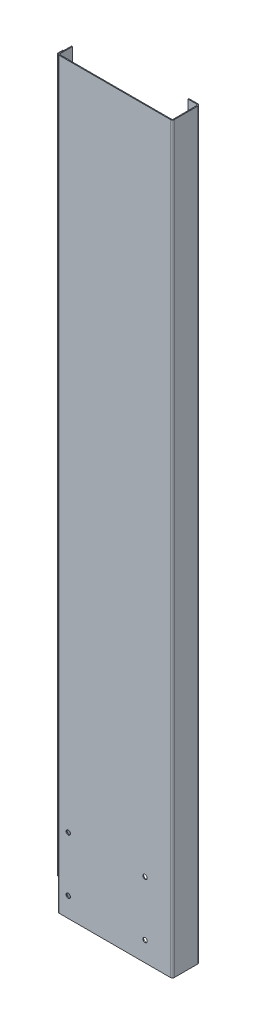
from build123d import *

# Parameters (mm, degrees)
SKETCH_15_W                      = 105
SKETCH_15_H                      = 678
SM_BASE_FLANGE_1_DEPTH           = 0.8
SM_EDGE_FLANGE_1_STRIP_W         = 5.2
SM_EDGE_FLANGE_1_STRIP_H         = 0.8
SM_EDGE_FLANGE_1_STRIP_CUT_DEPTH = 678
SM_EDGE_FLANGE_1_DEPTH           = 678
SM_EDGE_FLANGE_2_STRIP_W         = 5.2
SM_EDGE_FLANGE_2_STRIP_H         = 0.8
SM_EDGE_FLANGE_2_STRIP_CUT_DEPTH = 678
SM_EDGE_FLANGE_2_DEPTH           = 678
SM_EDGE_FLANGE_3_STRIP_W         = 5.2
SM_EDGE_FLANGE_3_STRIP_H         = 0.8
SM_EDGE_FLANGE_3_STRIP_CUT_DEPTH = 678
SM_EDGE_FLANGE_3_DEPTH           = 678
SM_EDGE_FLANGE_4_STRIP_W         = 5.2
SM_EDGE_FLANGE_4_STRIP_H         = 0.8
SM_EDGE_FLANGE_4_STRIP_CUT_DEPTH = 678
SM_EDGE_FLANGE_4_DEPTH           = 678
SKETCH_31_W                      = 16
SKETCH_31_H                      = 14.5
CUT_EXTRUDE_1_DEPTH              = 2
SM_EDGE_FLANGE_5_STRIP_W         = 5.2
SM_EDGE_FLANGE_5_STRIP_H         = 0.8
SM_EDGE_FLANGE_5_STRIP_CUT_DEPTH = 649
SM_EDGE_FLANGE_5_DEPTH           = 649
SKETCH_35_R                      = 1.75
CUT_EXTRUDE_2_DEPTH              = 10
SKETCH_36_R                      = 3
SKETCH_36_R_2                    = 1.25
EXTRUDE_1_DEPTH                  = 3
PATTERN_LINEAR_1_COUNT           = 2
PATTERN_LINEAR_1_PITCH           = 315
PATTERN_LINEAR_1_COUNT_DIR2      = 2
PATTERN_LINEAR_1_PITCH_DIR2      = 315
HOLE_WIZARD_4_0_4_1_D            = 4
HOLE_WIZARD_4_0_4_1_DEPTH        = 5.2
HOLE_WIZARD_4_0_4_1_TIP          = 1.201721238


# Sheet-metal steps are written as plain solids
with BuildPart() as part:
    # 草图15 → 基体-法兰1 (new body)
    with BuildSketch(Plane.XY):
        Rectangle(SKETCH_15_W, SKETCH_15_H)
    extrude(amount=-SM_BASE_FLANGE_1_DEPTH)

    # 边线-法兰1 strip (across the edge) → 边线-法兰1 strip cut (cut)
    with BuildSketch(Plane(origin=(52.5, 339, -0.8), x_dir=(-1, 0, 0), z_dir=(0, -1, 0))):
        with Locations((-0.8, -0.4)):
            Rectangle(SM_EDGE_FLANGE_1_STRIP_W, SM_EDGE_FLANGE_1_STRIP_H)
    extrude(amount=SM_EDGE_FLANGE_1_STRIP_CUT_DEPTH, mode=Mode.SUBTRACT)

    # 边线-法兰1 section (across the edge) → 边线-法兰1 (add)
    with BuildSketch(Plane(origin=(52.5, 339, -0.8), x_dir=(-1, 0, 0), z_dir=(0, -1, 0))):
        with BuildLine():
            Line((0, 1), (0, 24.2))
            Line((0, 24.2), (0.8, 24.2))
            Line((0.8, 24.2), (0.8, 1))
            ThreePointArc((0.8, 1), (1.092893219, 0.292893219), (1.8, 0))
            Line((1.8, 0), (1.8, -0.8))
            ThreePointArc((1.8, -0.8), (0.527207794, -0.272792206), (0, 1))
        make_face()
    extrude(amount=SM_EDGE_FLANGE_1_DEPTH)

    # 边线-法兰2 strip (across the edge) → 边线-法兰2 strip cut (cut)
    with BuildSketch(Plane(origin=(51.7, 339, -25), x_dir=(0, 0, 1), z_dir=(0, -1, 0))):
        with Locations((-0.8, -0.4)):
            Rectangle(SM_EDGE_FLANGE_2_STRIP_W, SM_EDGE_FLANGE_2_STRIP_H)
    extrude(amount=SM_EDGE_FLANGE_2_STRIP_CUT_DEPTH, mode=Mode.SUBTRACT)

    # 边线-法兰2 section (across the edge) → 边线-法兰2 (add)
    with BuildSketch(Plane(origin=(51.7, 339, -25), x_dir=(0, 0, 1), z_dir=(0, -1, 0))):
        with BuildLine():
            Line((0, 1), (0, 9.2))
            Line((0, 9.2), (0.8, 9.2))
            Line((0.8, 9.2), (0.8, 1))
            ThreePointArc((0.8, 1), (1.092893219, 0.292893219), (1.8, 0))
            Line((1.8, 0), (1.8, -0.8))
            ThreePointArc((1.8, -0.8), (0.527207794, -0.272792206), (0, 1))
        make_face()
    extrude(amount=SM_EDGE_FLANGE_2_DEPTH)

    # 边线-法兰3 strip (across the edge) → 边线-法兰3 strip cut (cut)
    with BuildSketch(Plane(origin=(-52.5, -339, -0.8), x_dir=(1, 0, 0), z_dir=(0, 1, 0))):
        with Locations((-0.8, -0.4)):
            Rectangle(SM_EDGE_FLANGE_3_STRIP_W, SM_EDGE_FLANGE_3_STRIP_H)
    extrude(amount=SM_EDGE_FLANGE_3_STRIP_CUT_DEPTH, mode=Mode.SUBTRACT)

    # 边线-法兰3 section (across the edge) → 边线-法兰3 (add)
    with BuildSketch(Plane(origin=(-52.5, -339, -0.8), x_dir=(1, 0, 0), z_dir=(0, 1, 0))):
        with BuildLine():
            Line((0, 1), (0, 14.2))
            Line((0, 14.2), (0.8, 14.2))
            Line((0.8, 14.2), (0.8, 1))
            ThreePointArc((0.8, 1), (1.092893219, 0.292893219), (1.8, 0))
            Line((1.8, 0), (1.8, -0.8))
            ThreePointArc((1.8, -0.8), (0.527207794, -0.272792206), (0, 1))
        make_face()
    extrude(amount=SM_EDGE_FLANGE_3_DEPTH)

    # 边线-法兰4 strip (across the edge) → 边线-法兰4 strip cut (cut)
    with BuildSketch(Plane(origin=(-52.5, 339, -15), x_dir=(0, 0, 1), z_dir=(0, -1, 0))):
        with Locations((-0.8, -0.4)):
            Rectangle(SM_EDGE_FLANGE_4_STRIP_W, SM_EDGE_FLANGE_4_STRIP_H)
    extrude(amount=SM_EDGE_FLANGE_4_STRIP_CUT_DEPTH, mode=Mode.SUBTRACT)

    # 边线-法兰4 section (across the edge) → 边线-法兰4 (add)
    with BuildSketch(Plane(origin=(-52.5, 339, -15), x_dir=(0, 0, 1), z_dir=(0, -1, 0))):
        with BuildLine():
            Line((0, 1), (0, 15.2))
            Line((0, 15.2), (0.8, 15.2))
            Line((0.8, 15.2), (0.8, 1))
            ThreePointArc((0.8, 1), (1.092893219, 0.292893219), (1.8, 0))
            Line((1.8, 0), (1.8, -0.8))
            ThreePointArc((1.8, -0.8), (0.527207794, -0.272792206), (0, 1))
        make_face()
    extrude(amount=SM_EDGE_FLANGE_4_DEPTH)

    # 草图31 → 切除-拉伸1 (cut)
    with BuildSketch(Plane(origin=(0, 0, -15), x_dir=(-1, 0, 0), z_dir=(0, 0, -1))):
        with Locations((59.7, -331.75)):
            Rectangle(SKETCH_31_W, SKETCH_31_H)
    cut_extrude_1 = extrude(amount=-CUT_EXTRUDE_1_DEPTH, mode=Mode.SUBTRACT)

    # 镜向1: 切除-拉伸1 across plane
    add(cut_extrude_1.mirror(Plane.ZX), mode=Mode.SUBTRACT)

    # 边线-法兰5 strip (across the edge) → 边线-法兰5 strip cut (cut)
    with BuildSketch(Plane(origin=(-67.7, -324.5, -15), x_dir=(1, 0, 0), z_dir=(0, 1, 0))):
        with Locations((-0.8, -0.4)):
            Rectangle(SM_EDGE_FLANGE_5_STRIP_W, SM_EDGE_FLANGE_5_STRIP_H)
    extrude(amount=SM_EDGE_FLANGE_5_STRIP_CUT_DEPTH, mode=Mode.SUBTRACT)

    # 边线-法兰5 section (across the edge) → 边线-法兰5 (add)
    with BuildSketch(Plane(origin=(-67.7, -324.5, -15), x_dir=(1, 0, 0), z_dir=(0, 1, 0))):
        with BuildLine():
            Line((0, 1), (0, 5.2))
            Line((0, 5.2), (0.8, 5.2))
            Line((0.8, 5.2), (0.8, 1))
            ThreePointArc((0.8, 1), (1.092893219, 0.292893219), (1.8, 0))
            Line((1.8, 0), (1.8, -0.8))
            ThreePointArc((1.8, -0.8), (0.527207794, -0.272792206), (0, 1))
        make_face()
    extrude(amount=SM_EDGE_FLANGE_5_DEPTH)

    # 草图35 → 切除-拉伸2 (cut)
    with BuildSketch(Plane.XY.offset(-14.2)):
        with Locations((-60, 0)):
            Circle(SKETCH_35_R)
    cut_extrude_2 = extrude(amount=-CUT_EXTRUDE_2_DEPTH, mode=Mode.SUBTRACT)

    # 草图36 → 凸台-拉伸1 (add)
    with BuildSketch(Plane(origin=(0, 0, -15), x_dir=(-1, 0, 0), z_dir=(0, 0, -1))):
        with Locations(Location((60, 0, 0), (0, 0, 180))):
            Circle(SKETCH_36_R)
        with Locations((60, 0)):
            Circle(SKETCH_36_R_2, mode=Mode.SUBTRACT)
    extrude_1 = extrude(amount=EXTRUDE_1_DEPTH)

    # 阵列(线性)1: 切除-拉伸2, Extrude 1 2 × 2
    with Locations(*[Vector(0, -1, 0) * (i * PATTERN_LINEAR_1_PITCH) + Vector(0, 1, 0) * (j * PATTERN_LINEAR_1_PITCH_DIR2) for i in range(PATTERN_LINEAR_1_COUNT) for j in range(PATTERN_LINEAR_1_COUNT_DIR2) if (i, j) != (0, 0)]):
        add(cut_extrude_2, mode=Mode.SUBTRACT)
        add(extrude_1)

    # Ø4.0 (4) 直径孔1
    with Locations(Plane.XY):
        with Locations((-42.5, -271), (-42.5, -321), (27.5, -321), (27.5, -271)):
            Hole(HOLE_WIZARD_4_0_4_1_D / 2, depth=HOLE_WIZARD_4_0_4_1_DEPTH)
            with Locations((0, 0, -(HOLE_WIZARD_4_0_4_1_DEPTH + HOLE_WIZARD_4_0_4_1_TIP / 2))):  # 118° drill point
                Cone(0, HOLE_WIZARD_4_0_4_1_D / 2, HOLE_WIZARD_4_0_4_1_TIP, mode=Mode.SUBTRACT)


solid = part.part
